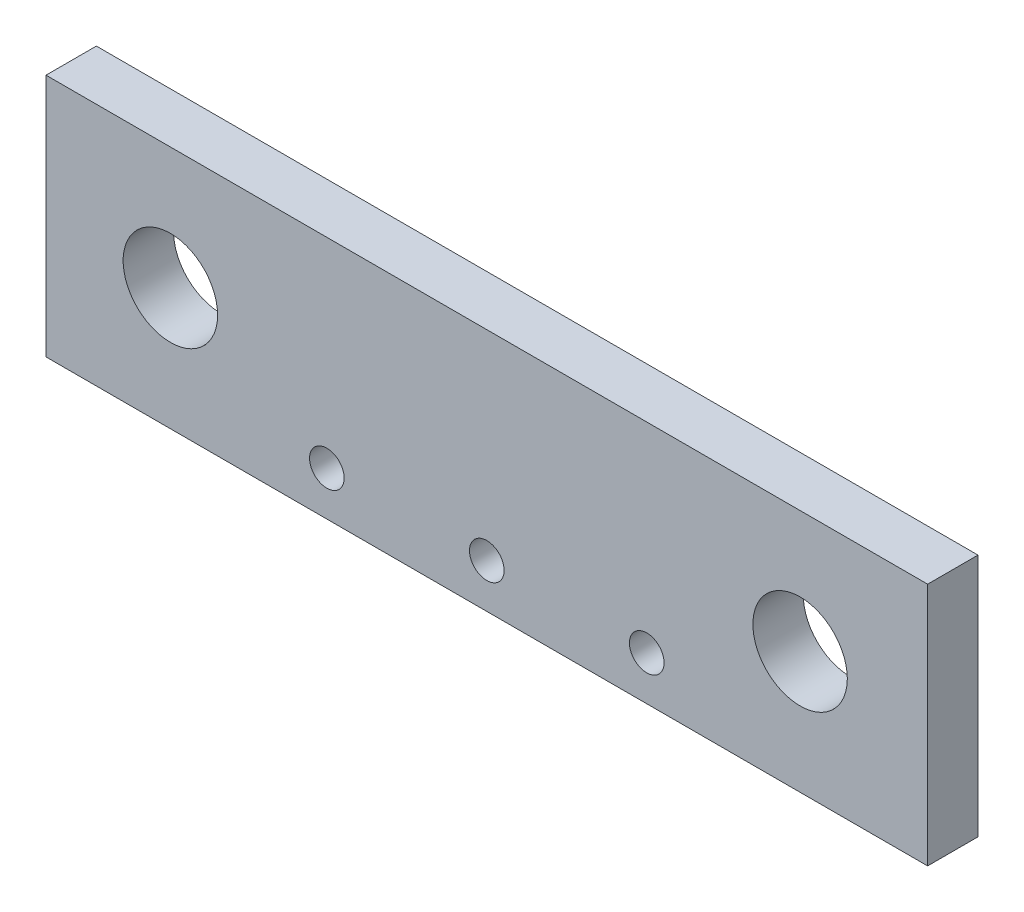
from build123d import *

# Parameters (mm, degrees)
SKETCH1_W           = 28
SKETCH1_H           = 7.75
BOSS_EXTRUDE1_DEPTH = 1.6
SKETCH2_R           = 1.5
CUT_EXTRUDE1_DEPTH  = 15.614226801
SKETCH3_R           = 0.55
CUT_EXTRUDE2_DEPTH  = 15.614226801


with BuildPart() as part:
    # Sketch1 → Boss-Extrude1 (new body)
    with BuildSketch(Plane.XY):
        Rectangle(SKETCH1_W, SKETCH1_H)
    extrude(amount=BOSS_EXTRUDE1_DEPTH)

    # Sketch2 → Cut-Extrude1 (cut, through all)
    with BuildSketch(Plane.XY.offset(1.6)):
        with Locations((-10.05, 0)):
            Circle(SKETCH2_R)
        with Locations((9.95, 0)):
            Circle(SKETCH2_R)
    extrude(amount=-CUT_EXTRUDE1_DEPTH, mode=Mode.SUBTRACT)

    # Sketch3 → Cut-Extrude2 (cut, through all)
    with BuildSketch(Plane.XY.offset(1.6)):
        with Locations((0, -2.475)):
            Circle(SKETCH3_R)
        with Locations((-5.08, -2.475)):
            Circle(SKETCH3_R)
        with Locations((5.08, -2.475)):
            Circle(SKETCH3_R)
    extrude(amount=-CUT_EXTRUDE2_DEPTH, mode=Mode.SUBTRACT)


solid = part.part
